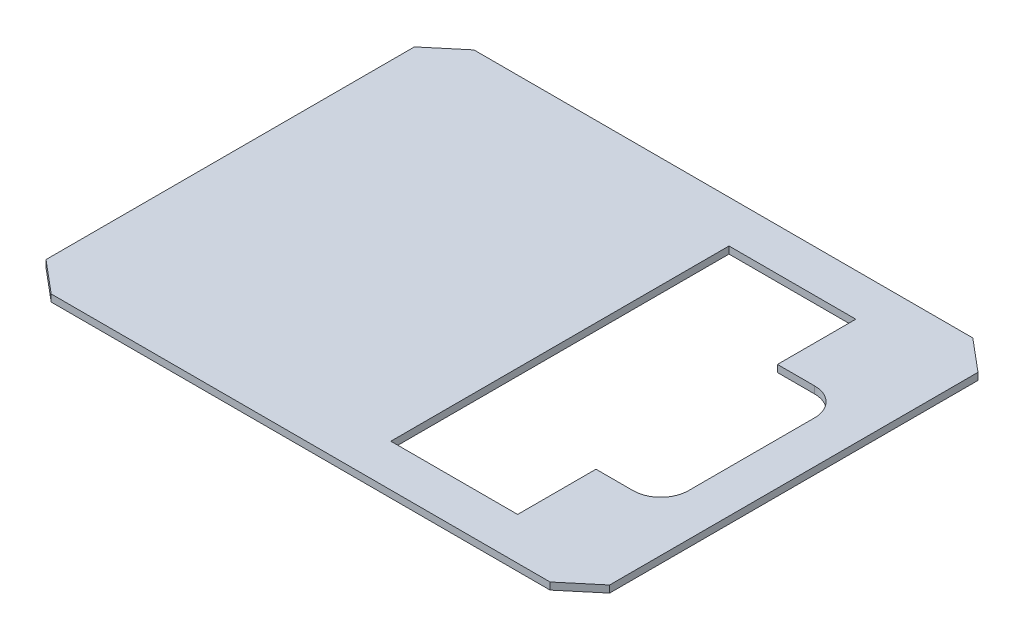
from build123d import *

# Parameters (mm, degrees)
BOSS_EXTRUDE1_DEPTH = 3.175
CUT_EXTRUDE1_DEPTH  = 159.781746826
FILLET1_R           = 12.446


with BuildPart() as part:
    # Sketch1 → Boss-Extrude1 (new body)
    with BuildSketch(Plane(origin=(0, 0, 0), x_dir=(1, 0, 0), z_dir=(0, 1, 0))):
        Polygon((112.406853359, -95.25), (127, -83.004896035), (127, 83.004896035), (112.406853359, 95.25), (-112.406853359, 95.25), (-127, 83.004896035), (-127, -83.004896035), (-112.406853359, -95.25), align=None)
    extrude(amount=BOSS_EXTRUDE1_DEPTH)

    # Sketch2 → Cut-Extrude1 (cut, through all)
    with BuildSketch(Plane(origin=(0, 3.175, 0), x_dir=(1, 0, 0), z_dir=(0, 1, 0))):
        Polygon((78.74, 40.894), (107.95, 40.894), (107.95, -40.894), (78.74, -40.894), (78.74, -76.2), (21.59, -76.2), (21.59, 76.2), (78.74, 76.2), align=None)
    extrude(amount=-CUT_EXTRUDE1_DEPTH, mode=Mode.SUBTRACT)

    # Fillet1
    fillet1_edges = [part.edges().sort_by_distance(p)[0] for p in [
        (107.95, 1.5875, 40.894),
        (107.95, 1.5875, -40.894),
    ]]
    fillet(fillet1_edges, radius=FILLET1_R)


solid = part.part
